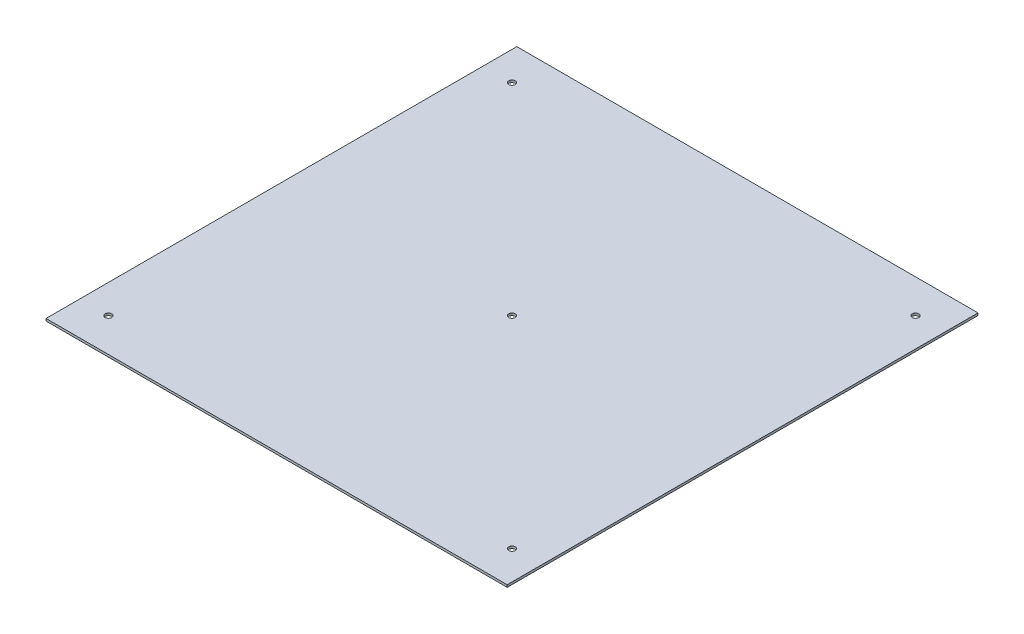
from build123d import *

# Parameters (mm, degrees)
SKETCH1_W            = 240
SKETCH1_H            = 245
BOSS_EXTRUDE1_DEPTH  = 1.2
M3_CLEARANCE_HOLE1_D = 3.4


with BuildPart() as part:
    # Sketch1 → Boss-Extrude1 (new body)
    with BuildSketch(Plane(origin=(0, 0, 0), x_dir=(1, 0, 0), z_dir=(0, 1, 0))):
        Rectangle(SKETCH1_W, SKETCH1_H)
    extrude(amount=BOSS_EXTRUDE1_DEPTH)

    # M3 Clearance Hole1 (through all)
    with Locations(Plane(origin=(0, 1.2, 0), x_dir=(1, 0, 0), z_dir=(0, 1, 0))):
        with Locations((0, 0), (105, 105), (-105, -105), (-105, 105), (105, -105)):
            Hole(M3_CLEARANCE_HOLE1_D / 2)


solid = part.part
